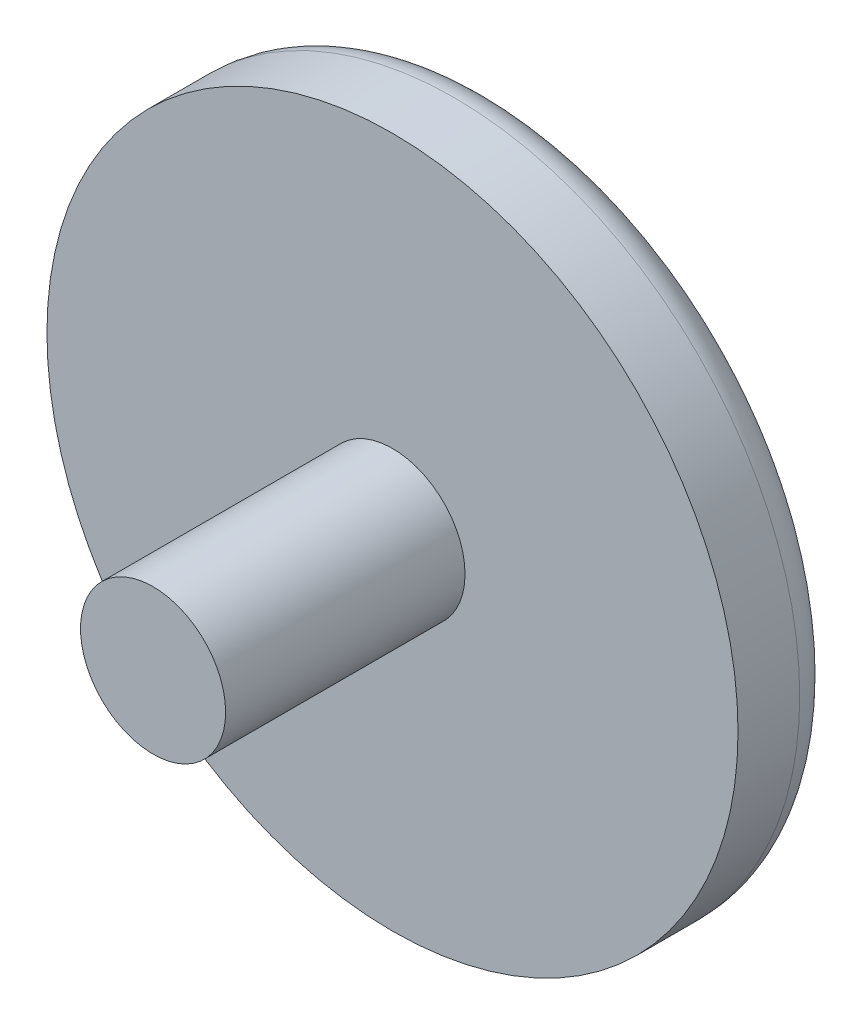
from build123d import *

# Parameters (mm, degrees)
SKETCH1_R           = 14
BOSS_EXTRUDE1_DEPTH = 4
SKETCH2_R           = 2.94
BOSS_EXTRUDE2_DEPTH = 9.7
SKETCH4_R           = 11
CUT_EXTRUDE1_DEPTH  = 1
FILLET1_R           = 0.5
FILLET2_R           = 1.5


with BuildPart() as part:
    # Sketch1 → Boss-Extrude1 (new body)
    with BuildSketch(Plane.XY):
        Circle(SKETCH1_R)
    extrude(amount=BOSS_EXTRUDE1_DEPTH)

    # Sketch2 → Boss-Extrude2 (add)
    with BuildSketch(Plane.XY.offset(4)):
        Circle(SKETCH2_R)
    extrude(amount=BOSS_EXTRUDE2_DEPTH)

    # Sketch4 → Cut-Extrude1 (cut)
    with BuildSketch(Plane(origin=(0, 0, 0), x_dir=(-1, 0, 0), z_dir=(0, 0, -1))):
        Circle(SKETCH4_R)
    extrude(amount=-CUT_EXTRUDE1_DEPTH, mode=Mode.SUBTRACT)

    # Fillet1
    fillet1_edges = [part.edges().sort_by_distance(p)[0] for p in [
        (11, 0, 1),
        (11, 0, 0),
    ]]
    fillet(fillet1_edges, radius=FILLET1_R - 0.0001)  # a hair under: the kernel refuses the full size

    # Fillet2
    fillet2_edges = [part.edges().sort_by_distance(p)[0] for p in [
        (-14, 0, 0),
    ]]
    fillet(fillet2_edges, radius=FILLET2_R)


solid = part.part
